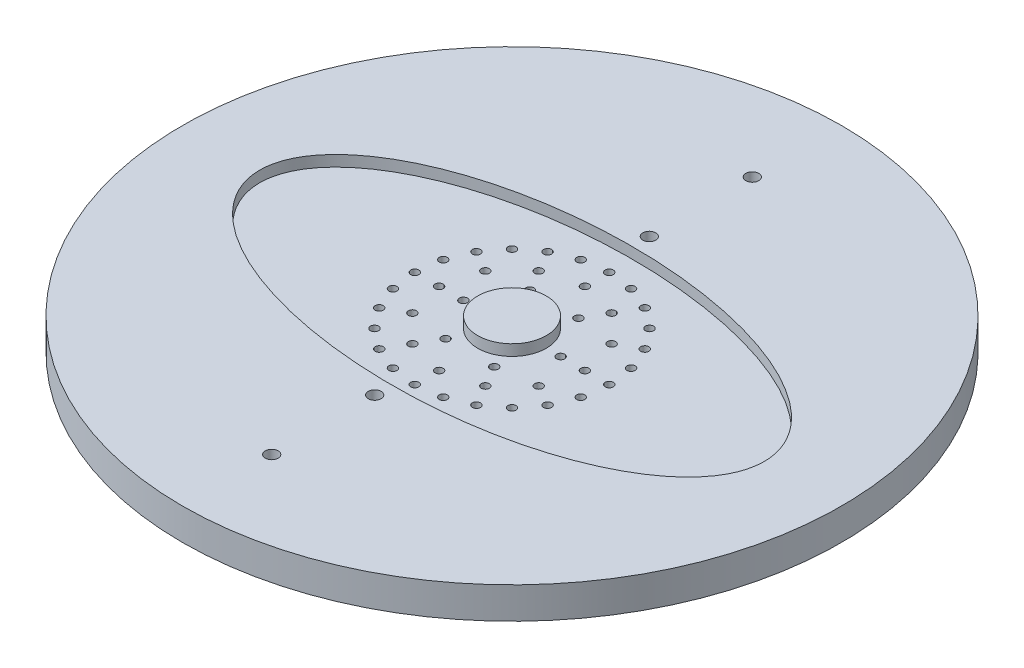
from build123d import *

# Parameters (mm, degrees)
SKETCH1_R                       = 60.96
BILLET_DEPTH                    = 5.842
SKETCH4_R                       = 0.7493
FIRST_KEROSENE_OUTLET_DEPTH     = 88.140881336
PRIMARY_HOLES_COUNT             = 6
SECOND_START                    = -5.842
SECOND_RING_OUTLINE_R           = 0.7493
SECOND_RING_DEPTH               = 5.842
THIRD_START                     = -5.842
THIRD_RING_OUTLINE_R            = 0.7493
THIRD_RING_DEPTH                = 5.842
SKETCH18_RX                     = 46.67504
SKETCH18_RY                     = 22.225
KEROSENE_WELL_DEPTH             = 2.032
SKETCH17_R                      = 6.35
BOSS_EXTRUDE1_DEPTH             = 2.54
BOSS_EXTRUDE1_DIRECTION_2_REACH = 88.408
SKETCH21_R                      = 6.35
CUT_EXTRUDE1_DEPTH              = 2.54
SKETCH32_R                      = 55.7149
SKETCH32_R_2                    = 51.6509
CUT_EXTRUDE5_DEPTH              = 2.6924
SKETCH20_R                      = 1.190625
CUT_EXTRUDE6_DEPTH              = 2.54


# Read off the part's stored shape, not the designer's step: Second ring, Third Ring
with BuildPart() as part:
    # Sketch1 → Billet (new body)
    with BuildSketch(Plane(origin=(0, 0, 0), x_dir=(1, 0, 0), z_dir=(0, 1, 0))):
        with Locations(Location((0, 0, 0), (0, 0, 270))):
            Circle(SKETCH1_R)
    extrude(amount=-BILLET_DEPTH)

    # Sketch4 → First Kerosene Outlet (cut, symmetric)
    with BuildSketch(Plane(origin=(0, -12.7, 0), x_dir=(1, 0, 0), z_dir=(0, 1, 0))):
        with Locations(Location((8.9916, 0, 0), (0, 0, 270))):
            Circle(SKETCH4_R)
        with Locations(Location((13.4874, 0, 0), (0, 0, 270))):
            Circle(SKETCH4_R)
        with Locations(Location((17.9832, 0, 0), (0, 0, 270))):
            Circle(SKETCH4_R)
    first_kerosene_outlet = extrude(amount=FIRST_KEROSENE_OUTLET_DEPTH, both=True, mode=Mode.SUBTRACT)

    # Primary Holes: First Kerosene Outlet ×6 about axis
    primary_holes_axis = Axis((0, 0, 0), (0, 1, 0))
    for i in range(1, PRIMARY_HOLES_COUNT):
        add(first_kerosene_outlet.rotate(primary_holes_axis, i * 360 / PRIMARY_HOLES_COUNT), mode=Mode.SUBTRACT)

    # Second ring outline → Second ring (cut)
    with BuildSketch(Plane(origin=(0, 0, 0), x_dir=(1, 0, 0), z_dir=(0, 1, 0)).offset(SECOND_START)):
        with Locations((11.680431031, 6.7437)):
            Circle(SECOND_RING_OUTLINE_R)
        with Locations((0, 13.4874)):
            Circle(SECOND_RING_OUTLINE_R)
        with Locations((-11.680431031, 6.7437)):
            Circle(SECOND_RING_OUTLINE_R)
        with Locations((-11.680431031, -6.7437)):
            Circle(SECOND_RING_OUTLINE_R)
        with Locations((0, -13.4874)):
            Circle(SECOND_RING_OUTLINE_R)
        with Locations((11.680431031, -6.7437)):
            Circle(SECOND_RING_OUTLINE_R)
    extrude(amount=SECOND_RING_DEPTH, mode=Mode.SUBTRACT)

    # Third Ring outline → Third Ring (cut)
    with BuildSketch(Plane(origin=(0, 0, 0), x_dir=(1, 0, 0), z_dir=(0, 1, 0)).offset(THIRD_START)):
        with Locations((17.370437319, 4.654394652)):
            Circle(THIRD_RING_OUTLINE_R)
        with Locations((15.573908041, 8.9916)):
            Circle(THIRD_RING_OUTLINE_R)
        with Locations((12.716042667, 12.716042667)):
            Circle(THIRD_RING_OUTLINE_R)
        with Locations((4.654394652, 17.370437319)):
            Circle(THIRD_RING_OUTLINE_R)
        with Locations((0, 17.9832)):
            Circle(THIRD_RING_OUTLINE_R)
        with Locations((-4.654394652, 17.370437319)):
            Circle(THIRD_RING_OUTLINE_R)
        with Locations((-12.716042667, 12.716042667)):
            Circle(THIRD_RING_OUTLINE_R)
        with Locations((-15.573908041, 8.9916)):
            Circle(THIRD_RING_OUTLINE_R)
        with Locations((-17.370437319, 4.654394652)):
            Circle(THIRD_RING_OUTLINE_R)
        with Locations((-17.370437319, -4.654394652)):
            Circle(THIRD_RING_OUTLINE_R)
        with Locations((-15.573908041, -8.9916)):
            Circle(THIRD_RING_OUTLINE_R)
        with Locations((-12.716042667, -12.716042667)):
            Circle(THIRD_RING_OUTLINE_R)
        with Locations((-4.654394652, -17.370437319)):
            Circle(THIRD_RING_OUTLINE_R)
        with Locations((0, -17.9832)):
            Circle(THIRD_RING_OUTLINE_R)
        with Locations((4.654394652, -17.370437319)):
            Circle(THIRD_RING_OUTLINE_R)
        with Locations((12.716042667, -12.716042667)):
            Circle(THIRD_RING_OUTLINE_R)
        with Locations((15.573908041, -8.9916)):
            Circle(THIRD_RING_OUTLINE_R)
        with Locations((17.370437319, -4.654394652)):
            Circle(THIRD_RING_OUTLINE_R)
    extrude(amount=THIRD_RING_DEPTH, mode=Mode.SUBTRACT)

    # Sketch18 → Kerosene Well (cut)
    with BuildSketch(Plane(origin=(0, 0, 0), x_dir=(1, 0, 0), z_dir=(0, 1, 0))):
        with Locations(Location((0, 0), (0, 0, -180))):
            Ellipse(SKETCH18_RX, SKETCH18_RY)
    extrude(amount=-KEROSENE_WELL_DEPTH, mode=Mode.SUBTRACT)

    # Sketch17 → Boss-Extrude1 (add)
    with BuildSketch(Plane(origin=(0, 0, 0), x_dir=(1, 0, 0), z_dir=(0, 1, 0))):
        with Locations(Location((0, 0, 0), (0, 0, 270))):
            Circle(SKETCH17_R)
    extrude(amount=BOSS_EXTRUDE1_DEPTH)

    # Sketch17 → Boss-Extrude1 direction 2 (add, up to next)
    with BuildSketch(Plane(origin=(0, 0, 0), x_dir=(1, 0, 0), z_dir=(0, 1, 0)), mode=Mode.PRIVATE) as boss_extrude1_direction_2_sk1:
        with Locations(Location((0, 0, 0), (0, 0, 270))):
            Circle(SKETCH17_R)
    boss_extrude1_direction_2_tool1 = extrude(boss_extrude1_direction_2_sk1.sketch, amount=-BOSS_EXTRUDE1_DIRECTION_2_REACH, mode=Mode.PRIVATE) - part.part
    add(boss_extrude1_direction_2_tool1.solids().sort_by_distance((0, 0, 0))[0])

    # Sketch21 → Cut-Extrude1 (cut)
    with BuildSketch(Plane(origin=(0, 2.54, 0), x_dir=(1, 0, 0), z_dir=(0, 1, 0))):
        with Locations(Location((0, 0, 0), (0, 0, 270))):
            Circle(SKETCH21_R)
    extrude(amount=-CUT_EXTRUDE1_DEPTH, mode=Mode.SUBTRACT)

    # Sketch32 → Cut-Extrude5 (cut)
    with BuildSketch(Plane.XZ.offset(5.842)):
        with Locations(Location((0, 0, 0), (0, 0, 270))):
            Circle(SKETCH32_R)
        with Locations(Location((0, 0, 0), (0, 0, 270))):
            Circle(SKETCH32_R_2, mode=Mode.SUBTRACT)
    extrude(amount=-CUT_EXTRUDE5_DEPTH, mode=Mode.SUBTRACT)

    # Sketch20 → Cut-Extrude6 (cut)
    with BuildSketch(Plane(origin=(0, 0, 0), x_dir=(1, 0, 0), z_dir=(0, 1, 0))):
        with Locations(Location((0, 25.4, 0), (0, 0, 270))):
            Circle(SKETCH20_R)
        with Locations(Location((0, -25.4, 0), (0, 0, 90))):
            Circle(SKETCH20_R)
        with Locations(Location((0, 44.45, 0), (0, 0, 270))):
            Circle(SKETCH20_R)
        with Locations(Location((0, -44.45, 0), (0, 0, 90))):
            Circle(SKETCH20_R)
    extrude(amount=-CUT_EXTRUDE6_DEPTH, mode=Mode.SUBTRACT)


solid = part.part
